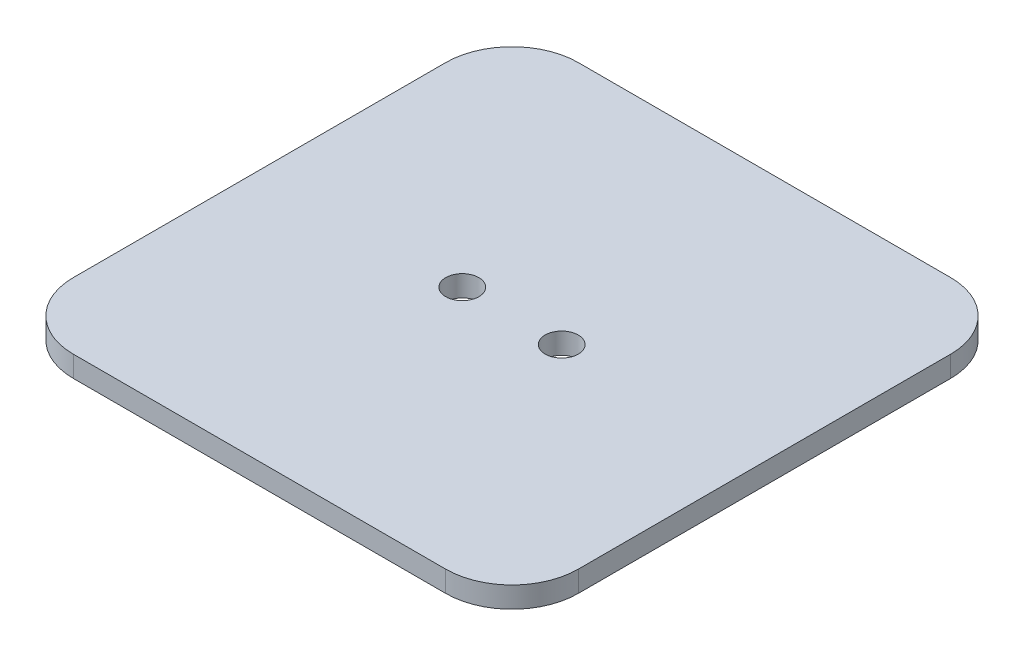
from build123d import *

# Parameters (mm, degrees)
SKETCH1_W           = 76.2
SKETCH1_H           = 76.2
BOSS_EXTRUDE1_DEPTH = 3.175
FILLET1_R           = 10
FILLET2_R           = 10
FILLET3_R           = 10
FILLET4_R           = 10
SKETCH2_R           = 2.5
CUT_EXTRUDE1_DEPTH  = 54.975


with BuildPart() as part:
    # Sketch1 → Boss-Extrude1 (new body)
    with BuildSketch(Plane(origin=(0, 0, 0), x_dir=(1, 0, 0), z_dir=(0, 1, 0))):
        Rectangle(SKETCH1_W, SKETCH1_H)
    extrude(amount=BOSS_EXTRUDE1_DEPTH)

    # Fillet1
    fillet1_edges = [part.edges().sort_by_distance(p)[0] for p in [
        (-38.1, 1.5875, 38.1),
    ]]
    fillet(fillet1_edges, radius=FILLET1_R)

    # Fillet2
    fillet2_edges = [part.edges().sort_by_distance(p)[0] for p in [
        (-38.1, 1.5875, -38.1),
    ]]
    fillet(fillet2_edges, radius=FILLET2_R)

    # Fillet3
    fillet3_edges = [part.edges().sort_by_distance(p)[0] for p in [
        (38.1, 1.5875, -38.1),
    ]]
    fillet(fillet3_edges, radius=FILLET3_R)

    # Fillet4
    fillet4_edges = [part.edges().sort_by_distance(p)[0] for p in [
        (38.1, 1.5875, 38.1),
    ]]
    fillet(fillet4_edges, radius=FILLET4_R)

    # Sketch2 → Cut-Extrude1 (cut, through all)
    with BuildSketch(Plane(origin=(0, 3.175, 0), x_dir=(1, 0, 0), z_dir=(0, 1, 0))):
        with Locations((7.5, 0)):
            Circle(SKETCH2_R)
        with Locations((-7.5, 0)):
            Circle(SKETCH2_R)
    extrude(amount=-CUT_EXTRUDE1_DEPTH, mode=Mode.SUBTRACT)


solid = part.part
